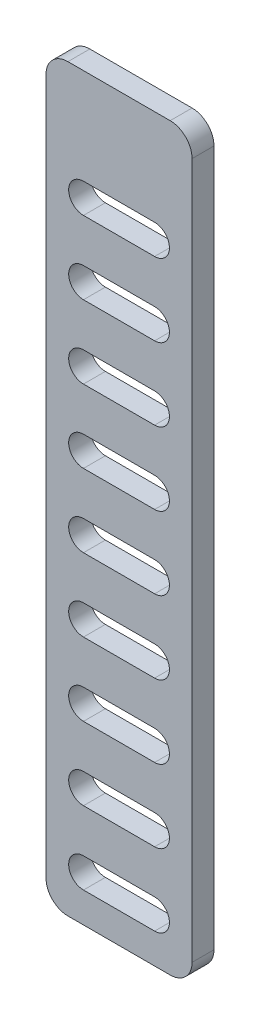
from build123d import *

# Parameters (mm, degrees)
SKETCH1_W           = 20
SKETCH1_H           = 101.315398587
BOSS_EXTRUDE1_DEPTH = 3
FILLET1_R           = 3


with BuildPart() as part:
    # Sketch1 → Boss-Extrude1 (new body)
    with BuildSketch(Plane.XY):
        with Locations((-91.066816784, 84.566254488)):
            Rectangle(SKETCH1_W, SKETCH1_H)
        with BuildLine():
            Line((-86.19596438, 38.053580074), (-95.937669189, 38.053580074))
            ThreePointArc((-95.937669189, 38.053580074), (-97.965327886, 40.081238771), (-95.937669189, 42.108897468))
            Line((-95.937669189, 42.108897468), (-86.19596438, 42.108897468))
            ThreePointArc((-86.19596438, 42.108897468), (-84.168305683, 40.081238771), (-86.19596438, 38.053580074))
        make_face(mode=Mode.SUBTRACT)
        with BuildLine():
            Line((-86.19596438, 48.053580074), (-95.937669189, 48.053580074))
            ThreePointArc((-95.937669189, 48.053580074), (-97.965327886, 50.081238771), (-95.937669189, 52.108897468))
            Line((-95.937669189, 52.108897468), (-86.19596438, 52.108897468))
            ThreePointArc((-86.19596438, 52.108897468), (-84.168305683, 50.081238771), (-86.19596438, 48.053580074))
        make_face(mode=Mode.SUBTRACT)
        with BuildLine():
            Line((-86.19596438, 58.053580074), (-95.937669189, 58.053580074))
            ThreePointArc((-95.937669189, 58.053580074), (-97.965327886, 60.081238771), (-95.937669189, 62.108897468))
            Line((-95.937669189, 62.108897468), (-86.19596438, 62.108897468))
            ThreePointArc((-86.19596438, 62.108897468), (-84.168305683, 60.081238771), (-86.19596438, 58.053580074))
        make_face(mode=Mode.SUBTRACT)
        with BuildLine():
            Line((-86.19596438, 68.053580074), (-95.937669189, 68.053580074))
            ThreePointArc((-95.937669189, 68.053580074), (-97.965327886, 70.081238771), (-95.937669189, 72.108897468))
            Line((-95.937669189, 72.108897468), (-86.19596438, 72.108897468))
            ThreePointArc((-86.19596438, 72.108897468), (-84.168305683, 70.081238771), (-86.19596438, 68.053580074))
        make_face(mode=Mode.SUBTRACT)
        with BuildLine():
            Line((-86.19596438, 78.053580074), (-95.937669189, 78.053580074))
            ThreePointArc((-95.937669189, 78.053580074), (-97.965327886, 80.081238771), (-95.937669189, 82.108897468))
            Line((-95.937669189, 82.108897468), (-86.19596438, 82.108897468))
            ThreePointArc((-86.19596438, 82.108897468), (-84.168305683, 80.081238771), (-86.19596438, 78.053580074))
        make_face(mode=Mode.SUBTRACT)
        with BuildLine():
            Line((-86.19596438, 88.053580074), (-95.937669189, 88.053580074))
            ThreePointArc((-95.937669189, 88.053580074), (-97.965327886, 90.081238771), (-95.937669189, 92.108897468))
            Line((-95.937669189, 92.108897468), (-86.19596438, 92.108897468))
            ThreePointArc((-86.19596438, 92.108897468), (-84.168305683, 90.081238771), (-86.19596438, 88.053580074))
        make_face(mode=Mode.SUBTRACT)
        with BuildLine():
            Line((-86.19596438, 98.053580074), (-95.937669189, 98.053580074))
            ThreePointArc((-95.937669189, 98.053580074), (-97.965327886, 100.081238771), (-95.937669189, 102.108897468))
            Line((-95.937669189, 102.108897468), (-86.19596438, 102.108897468))
            ThreePointArc((-86.19596438, 102.108897468), (-84.168305683, 100.081238771), (-86.19596438, 98.053580074))
        make_face(mode=Mode.SUBTRACT)
        with BuildLine():
            Line((-86.19596438, 108.053580074), (-95.937669189, 108.053580074))
            ThreePointArc((-95.937669189, 108.053580074), (-97.965327886, 110.081238771), (-95.937669189, 112.108897468))
            Line((-95.937669189, 112.108897468), (-86.19596438, 112.108897468))
            ThreePointArc((-86.19596438, 112.108897468), (-84.168305683, 110.081238771), (-86.19596438, 108.053580074))
        make_face(mode=Mode.SUBTRACT)
        with BuildLine():
            Line((-86.19596438, 118.053580074), (-95.937669189, 118.053580074))
            ThreePointArc((-95.937669189, 118.053580074), (-97.965327886, 120.081238771), (-95.937669189, 122.108897468))
            Line((-95.937669189, 122.108897468), (-86.19596438, 122.108897468))
            ThreePointArc((-86.19596438, 122.108897468), (-84.168305683, 120.081238771), (-86.19596438, 118.053580074))
        make_face(mode=Mode.SUBTRACT)
    extrude(amount=BOSS_EXTRUDE1_DEPTH)

    # Fillet1
    fillet1_edges = [part.edges().sort_by_distance(p)[0] for p in [
        (-101.066816784, 135.223953781, 1.5),
        (-81.066816784, 135.223953781, 1.5),
        (-101.066816784, 33.908555194, 1.5),
        (-81.066816784, 33.908555194, 1.5),
    ]]
    fillet(fillet1_edges, radius=FILLET1_R)


solid = part.part
